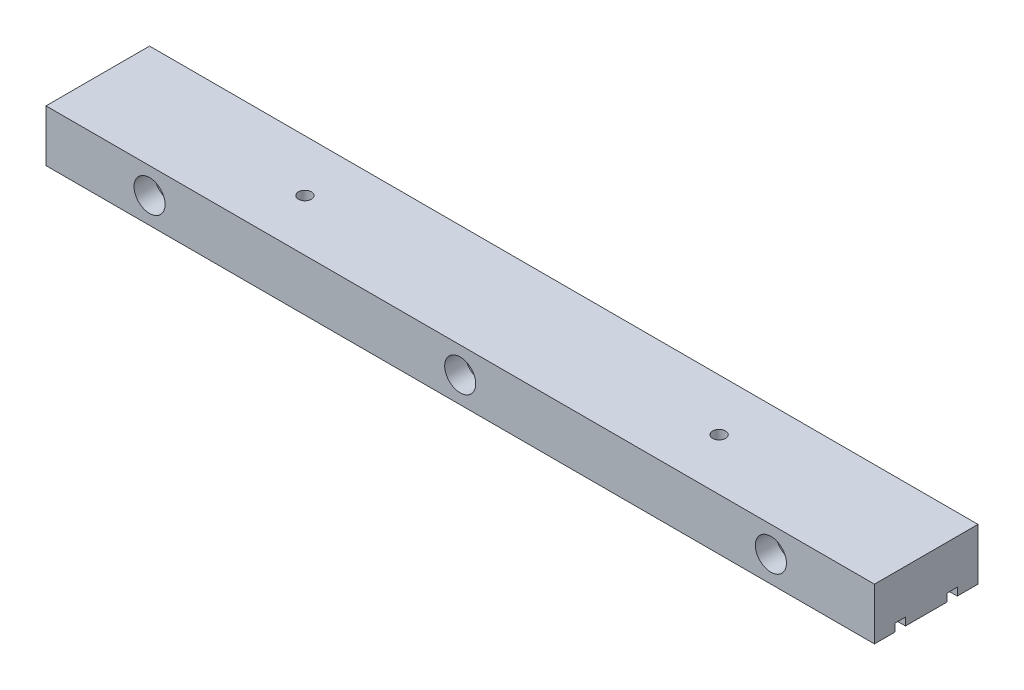
from build123d import *

# Parameters (mm, degrees)
IZIM1_W                     = 160
IZIM1_H                     = 10
Y_KSEKLIK_EKSTR_ZYON1_DEPTH = 20
IZIM6_W                     = 2
IZIM6_H                     = 1.5
KES_EKSTR_ZYON1_DEPTH       = 162.554944214
IZIM4_R                     = 1.25
CUT_EXTRUDE1_DEPTH          = 162.554944214
IZIM7_R                     = 1.25
CUT_EXTRUDE2_DEPTH          = 162.554944214
SKETCH1_R                   = 3
CUT_EXTRUDE3_DEPTH          = 4
CUT_EXTRUDE4_START          = -4
SKETCH2_R                   = 3
CUT_EXTRUDE4_DEPTH          = 4


with BuildPart() as part:
    # Çizim1 → Yükseklik-Ekstrüzyon1 (new body)
    with BuildSketch(Plane.XY):
        with Locations((80, 5)):
            Rectangle(IZIM1_W, IZIM1_H)
    extrude(amount=Y_KSEKLIK_EKSTR_ZYON1_DEPTH)

    # Çizim6 → Kes-Ekstrüzyon1 (cut, through all)
    with BuildSketch(Plane.ZY):
        with Locations((5, 0.75)):
            Rectangle(IZIM6_W, IZIM6_H)
        with Locations((15, 0.75)):
            Rectangle(IZIM6_W, IZIM6_H)
    extrude(amount=-KES_EKSTR_ZYON1_DEPTH, mode=Mode.SUBTRACT)

    # Çizim4 → Cut-Extrude1 (cut, through all)
    with BuildSketch(Plane(origin=(0, 10, 0), x_dir=(1, 0, 0), z_dir=(0, 1, 0))):
        with Locations((40, -10)):
            Circle(IZIM4_R)
        with Locations((120, -10)):
            Circle(IZIM4_R)
    extrude(amount=-CUT_EXTRUDE1_DEPTH, mode=Mode.SUBTRACT)

    # Çizim7 → Cut-Extrude2 (cut, through all)
    with BuildSketch(Plane(origin=(0, 0, 0), x_dir=(-1, 0, 0), z_dir=(0, 0, -1))):
        with Locations((-140, 5)):
            Circle(IZIM7_R)
        with Locations((-80, 5)):
            Circle(IZIM7_R)
        with Locations((-20, 5)):
            Circle(IZIM7_R)
    extrude(amount=-CUT_EXTRUDE2_DEPTH, mode=Mode.SUBTRACT)

    # Sketch1 → Cut-Extrude3 (cut)
    with BuildSketch(Plane(origin=(0, 0, 0), x_dir=(-1, 0, 0), z_dir=(0, 0, -1))):
        with Locations((-140, 5)):
            Circle(SKETCH1_R)
        with Locations((-80, 5)):
            Circle(SKETCH1_R)
        with Locations((-20, 5)):
            Circle(SKETCH1_R)
    extrude(amount=-CUT_EXTRUDE3_DEPTH, mode=Mode.SUBTRACT)

    # Sketch2 → Cut-Extrude4 (cut)
    with BuildSketch(Plane.XY.offset(20).offset(CUT_EXTRUDE4_START)):
        with Locations((20, 5)):
            Circle(SKETCH2_R)
        with Locations((80, 5)):
            Circle(SKETCH2_R)
        with Locations((140, 5)):
            Circle(SKETCH2_R)
    extrude(amount=CUT_EXTRUDE4_DEPTH, mode=Mode.SUBTRACT)


solid = part.part
